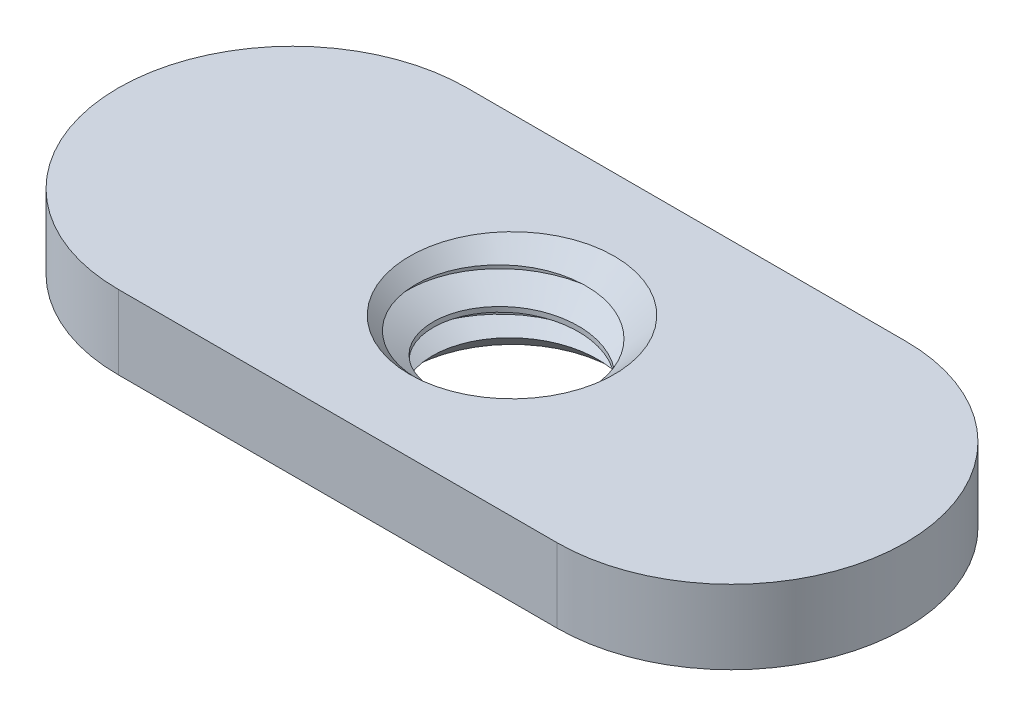
from build123d import *

# Parameters (mm, degrees)
BOSS_EXTRUDE1_START   = 1.5748
SKETCH3_R             = 3.175
BOSS_EXTRUDE1_DEPTH   = 2.3876
SKETCH4_R             = 3.5687
SKETCH4_R_2           = 3.175
BOSS_EXTRUDE2_DEPTH   = 0.762
SKETCH5_R             = 3.175
BOSS_EXTRUDE3_DEPTH   = 3.1496
DELETEFACE1_START     = -1.5748
DELETEFACE1_OUTLINE_R = 3.175
DELETEFACE1_DEPTH     = 3.1496
CUT_SWEEP1_PITCH      = 1.27


# Read off the part's stored shape, not the designer's step: DeleteFace1
with BuildPart() as part:
    # Sketch3 → Boss-Extrude1 (new body)
    with BuildSketch(Plane(origin=(0, 0, 0), x_dir=(1, 0, 0), z_dir=(0, 1, 0)).offset(BOSS_EXTRUDE1_START)):
        with BuildLine():
            Line((7.0739, -5.6261), (-7.0739, -5.6261))
            ThreePointArc((-7.0739, -5.6261), (-12.7, 0), (-7.0739, 5.6261))
            Line((-7.0739, 5.6261), (7.0739, 5.6261))
            ThreePointArc((7.0739, 5.6261), (12.7, 0), (7.0739, -5.6261))
        make_face()
        with Locations(Location((0, 0, 0), (0, 0, 270))):
            Circle(SKETCH3_R, mode=Mode.SUBTRACT)
    extrude(amount=-BOSS_EXTRUDE1_DEPTH)

    # Sketch4 → Boss-Extrude2 (add)
    with BuildSketch(Plane.XZ.offset(0.8128)):
        with Locations(Location((0, 0, 0), (0, 0, 90))):
            Circle(SKETCH4_R)
        with Locations(Location((0, 0, 0), (0, 0, 90))):
            Circle(SKETCH4_R_2, mode=Mode.SUBTRACT)
    extrude(amount=BOSS_EXTRUDE2_DEPTH)

    # DeleteFace1 outline → DeleteFace1 (add)
    with BuildSketch(Plane(origin=(0, 0, 0), x_dir=(1, 0, 0), z_dir=(0, 1, 0)).offset(DELETEFACE1_START)):
        Circle(DELETEFACE1_OUTLINE_R)
    extrude(amount=DELETEFACE1_DEPTH)


with BuildPart() as body_2:
    # Sketch5 → Boss-Extrude3 (new body)
    with BuildSketch(Plane(origin=(0, 1.5748, 0), x_dir=(1, 0, 0), z_dir=(0, 1, 0))):
        with Locations(Location((0, 0, 0), (0, 0, 270))):
            Circle(SKETCH5_R)
    extrude(amount=-BOSS_EXTRUDE3_DEPTH)

    # Cut-Sweep1: the profile of Sketch7 profile screwed along a right-hand helix of 3.48 turns, 8 arcs to a turn; built about Z, then put on its axis
    cut_sweep1_z = Axis((0, 0, 0), (0, 0, 1))
    cut_sweep1_corners = [(3.1753, 0, 0.000173205), (2.350110803, 0, -0.47625), (2.350110803, 0, -0.635), (3.1753, 0, -1.111423205)]
    with BuildLine(mode=Mode.PRIVATE) as cut_sweep1_profile:
        Line(cut_sweep1_corners[0], cut_sweep1_corners[1])
        Line(cut_sweep1_corners[1], cut_sweep1_corners[2])
        Line(cut_sweep1_corners[2], cut_sweep1_corners[3])
        Line(cut_sweep1_corners[3], cut_sweep1_corners[0])
    cut_sweep1_cap = Face(cut_sweep1_profile.wire())
    cut_sweep1_turn_angles = [0, 22.5, 45, 67.5, 90, 112.5, 135, 157.5, 180, 202.5, 225, 247.5, 270, 292.5, 315, 337.5, 360]
    cut_sweep1_turn_weights = [1, 0.9238795325112867, 1, 0.9238795325112867, 1, 0.9238795325112867, 1, 0.9238795325112867, 1, 0.9238795325112867, 1, 0.9238795325112867, 1, 0.9238795325112867, 1, 0.9238795325112867, 1]
    cut_sweep1_turn_rails = [Edge.make_bspline([Vector(p[0], p[1], 0).rotate(cut_sweep1_z, cut_sweep1_turn_angles[k]) / cut_sweep1_turn_weights[k] + Vector(0, 0, p[2] + CUT_SWEEP1_PITCH * cut_sweep1_turn_angles[k] / 360) for k in range(17)], [0, 0, 0, 1, 1, 2, 2, 3, 3, 4, 4, 5, 5, 6, 6, 7, 7, 8, 8, 8], 2, cut_sweep1_turn_weights) for p in cut_sweep1_corners]
    cut_sweep1_turn_sides = [Face.make_surface_from_curves(cut_sweep1_turn_rails[p[0]], cut_sweep1_turn_rails[p[1]]) for p in [(0, 1), (1, 2), (2, 3), (3, 0)]]
    cut_sweep1_last_angles = [1080, 1102.5, 1125, 1147.5, 1170, 1192.5, 1215, 1233.9, 1252.8]
    cut_sweep1_last_weights = [1, 0.9238795325112867, 1, 0.9238795325112867, 1, 0.9238795325112867, 1, 0.9460853588275384, 1]
    cut_sweep1_last_rails = [Edge.make_bspline([Vector(p[0], p[1], 0).rotate(cut_sweep1_z, cut_sweep1_last_angles[k]) / cut_sweep1_last_weights[k] + Vector(0, 0, p[2] + CUT_SWEEP1_PITCH * cut_sweep1_last_angles[k] / 360) for k in range(9)], [0, 0, 0, 1, 1, 2, 2, 3, 3, 4, 4, 4], 2, cut_sweep1_last_weights) for p in cut_sweep1_corners]
    cut_sweep1_last_sides = [Face.make_surface_from_curves(cut_sweep1_last_rails[p[0]], cut_sweep1_last_rails[p[1]]) for p in [(0, 1), (1, 2), (2, 3), (3, 0)]]
    cut_sweep1 = Plane(origin=(0, 1.5748, 0), x_dir=(1, 0, 0), z_dir=(0, -1, 0)) * Solid(Shell([*[p.moved(Location((0, 0, CUT_SWEEP1_PITCH * i))) for i in range(3) for p in cut_sweep1_turn_sides], *cut_sweep1_last_sides, cut_sweep1_cap, cut_sweep1_cap.rotate(cut_sweep1_z, 1252.8).moved(Location((0, 0, CUT_SWEEP1_PITCH * 1252.8 / 360)))]))
    add(cut_sweep1, mode=Mode.SUBTRACT)


with BuildPart() as part_1:
    add(part.part)

    # Combine1: cut body 2
    add(body_2.part, mode=Mode.SUBTRACT)

    # Cut-Extrude1 cone 1 section (through the dimple's axis) → Cut-Extrude1 (revolve, cut)
    with BuildSketch(Plane(origin=(0, 1.5748, 0), x_dir=(0, 0, 1), z_dir=(1, 0, 0))):
        Polygon((0, 0), (3.302, 0), (0, 3.302), align=None)
    cut_extrude1 = revolve(axis=Axis((0, 1.5748, 0), (0, -1, 0)), mode=Mode.SUBTRACT)

    # Mirror1: Cut-Extrude1 across plane
    add(cut_extrude1.mirror(Plane.ZX), mode=Mode.SUBTRACT)


solid = part_1.part
